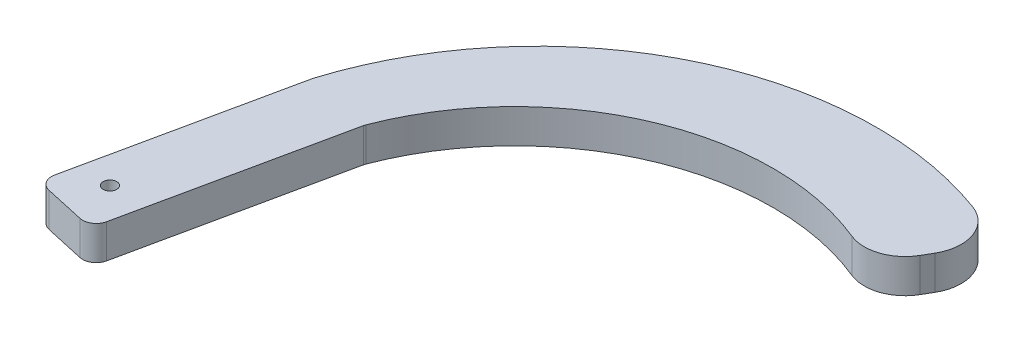
from build123d import *

# Parameters (mm, degrees)
SKETCH1_R           = 1.27
BOSS_EXTRUDE1_DEPTH = 6.35
FILLET1_R           = 7.62
FILLET2_R           = 2.54


with BuildPart() as part:
    # Sketch1 → Boss-Extrude1 (new body)
    with BuildSketch(Plane(origin=(0, 0, 0), x_dir=(1, 0, 0), z_dir=(0, 1, 0))):
        with BuildLine():
            Line((81.778930412, 21.890352424), (90.625383348, 37.130352424))
            ThreePointArc((90.625383348, 37.130352424), (36.535362906, 39.988317454), (0, 0))
            Line((0, 0), (-9.024498495, -42.227981756))
            Line((-9.024498495, -42.227981756), (3.372757994, -44.986498939))
            Line((3.372757994, -44.986498939), (12.397256489, -2.758517182))
            ThreePointArc((12.397256489, -2.758517182), (41.38133196, 25.629318142), (81.778930412, 21.890352424))
        make_face()
        with Locations(Location((-1.635035265, -36.315193683, 0), (0, 0, 270))):
            Circle(SKETCH1_R, mode=Mode.SUBTRACT)
    extrude(amount=BOSS_EXTRUDE1_DEPTH)

    # Fillet1
    fillet1_edges = [part.edges().sort_by_distance(p)[0] for p in [
        (90.625383348, 3.175, -37.130352424),
        (81.778930412, 3.175, -21.890352424),
    ]]
    fillet(fillet1_edges, radius=FILLET1_R)

    # Fillet2
    # the kernel refuses this fillet: 2.54 mm, written as the material it adds along each edge
    with BuildSketch(Plane(origin=(12.397256489, 0, 2.758517182), x_dir=(0.35622264546587595, 0, -0.9344011059803455), z_dir=(0, 1, 0))) as fillet2_piece_1:
        with BuildLine():
            CenterArc((0.195594606, -2.539994503), FILLET2_R, 89.880796264, 8.924440748)
            Line((-0.193218847, -0.029929942), (0, 0))
            ThreePointArc((0, 0), (0.100439533, 0.000104482), (0.200879066, 0))
        make_face()
    extrude(amount=6.35)
    # the kernel refuses this fillet: 2.54 mm, written as the material it takes off along each edge
    with BuildSketch(Plane(origin=(3.372757994, -6.403575534, 44.986498939), x_dir=(0.20898980989256036, 0, -0.9779178183063603), z_dir=(0, 1, 0))) as fillet2_2_piece_1:
        with BuildLine():
            CenterArc((FILLET2_R * 1.00843709196, FILLET2_R), FILLET2_R, 179.518623791, 90.481376209)
            Line((FILLET2_R * 0.00847238518745, FILLET2_R * 1.00840150095), (0, 0))
            Line((0, 0), (FILLET2_R * 1.00843709196, 0))
        make_face()
    extrude(amount=19.157151068, mode=Mode.SUBTRACT)
    with BuildSketch(Plane(origin=(-9.024498495, -6.296872706, 42.227981756), x_dir=(0.20898980989255983, 0, -0.9779178183063605), z_dir=(0, 1, 0))) as fillet2_2_piece_2:
        with BuildLine():
            CenterArc((FILLET2_R * 0.991633497, -FILLET2_R), FILLET2_R, 90, 89.518623791)
            Line((-FILLET2_R * 0.00833120976845, -FILLET2_R * 0.991598499049), (0, 0))
            Line((0, 0), (FILLET2_R * 0.991633497, 0))
        make_face()
    extrude(amount=18.943745412, mode=Mode.SUBTRACT)
    with BuildSketch(Plane(origin=(0, -0.288692893, 0), x_dir=(0.29511712664232287, 0, -0.9554610832275584), z_dir=(0, 1, 0))) as fillet2_2_piece_3:
        with BuildLine():
            CenterArc((0.11316262, -2.539998945), FILLET2_R, 89.947790074, 5.153611753)
            Line((-0.112690792, -0.010060164), (0, 0))
            ThreePointArc((0, 0), (0.057738579, 2.6307e-05), (0.115477157, 0))
        make_face()
    extrude(amount=6.927385787, mode=Mode.SUBTRACT)


solid = part.part
